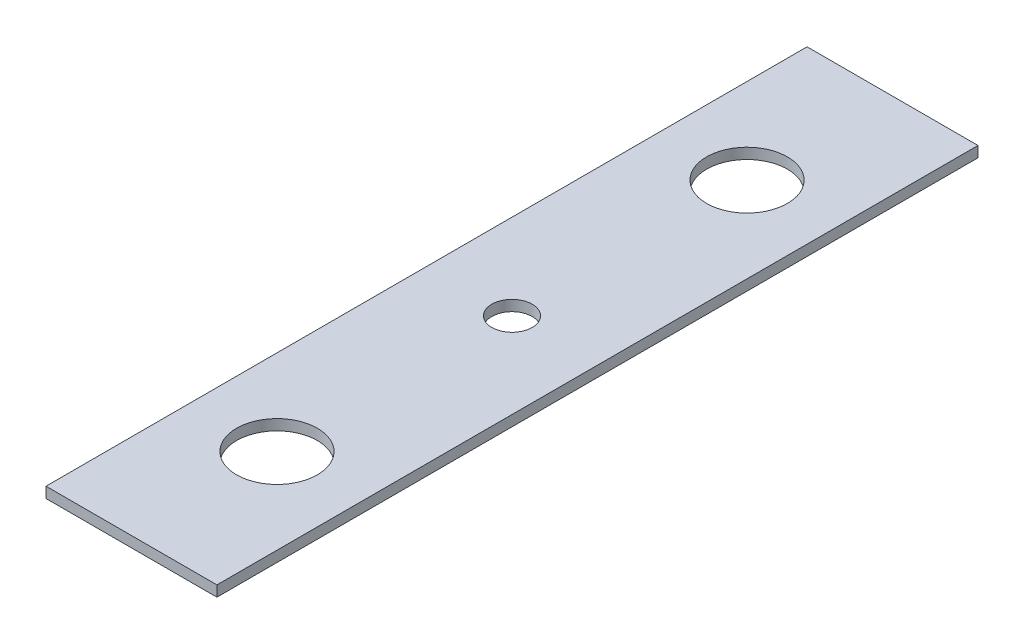
from build123d import *

# Parameters (mm, degrees)
SKETCH1_W           = 12.7
SKETCH1_H           = 56.55
SKETCH1_R           = 3
SKETCH1_R_2         = 1.5
BOSS_EXTRUDE1_DEPTH = 0.79375


with BuildPart() as part:
    # Sketch1 → Boss-Extrude1 (new body)
    with BuildSketch(Plane(origin=(0, 0, 0), x_dir=(1, 0, 0), z_dir=(0, 1, 0))):
        with Locations((202.847582207, 25.029038276)):
            Rectangle(SKETCH1_W, SKETCH1_H)
        with Locations((202.847582207, 7.566538276)):
            Circle(SKETCH1_R, mode=Mode.SUBTRACT)
        with Locations((202.847582207, 25.029038276)):
            Circle(SKETCH1_R_2, mode=Mode.SUBTRACT)
        with Locations((202.847582207, 42.491538276)):
            Circle(SKETCH1_R, mode=Mode.SUBTRACT)
    extrude(amount=BOSS_EXTRUDE1_DEPTH)


solid = part.part
